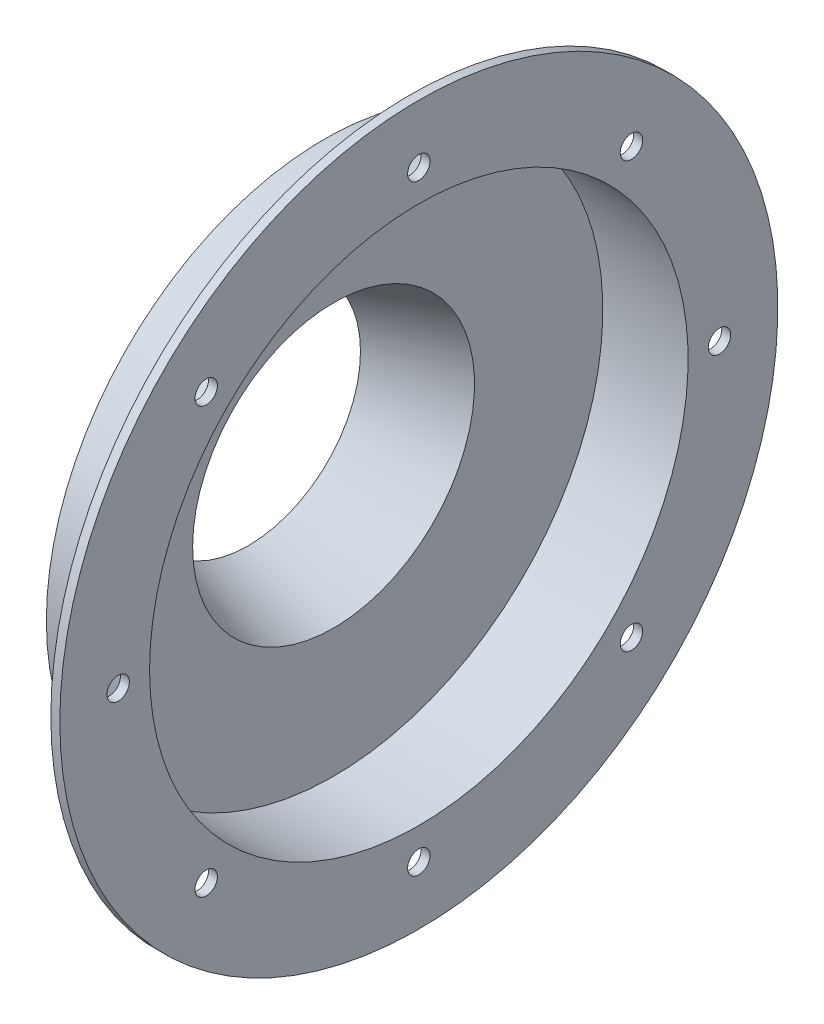
from build123d import *

# Parameters (mm, degrees)
SKETCH2_R          = 3.175
CUT_EXTRUDE1_DEPTH = 2.54
CIRPATTERN1_COUNT  = 8


with BuildPart() as part:
    # Sketch1 → Revolve1 (revolve)
    with BuildSketch(Plane.XY):
        Polygon((0, 31.75), (24.13, 39.878), (24.13, 76.2), (48.26, 76.2), (48.26, 101.6), (45.72, 101.6), (45.72, 78.74), (21.59, 78.74), (21.59, 41.702647785), (-0.810815928, 34.157109788), align=None)
    revolve(axis=Axis((0, 0, 0), (1, 0, 0)))

    # Sketch2 → Cut-Extrude1 (cut)
    with BuildSketch(Plane.ZY.offset(-45.72)):
        with Locations((0, 85.09)):
            Circle(SKETCH2_R)
    cut_extrude1 = extrude(amount=-CUT_EXTRUDE1_DEPTH, mode=Mode.SUBTRACT)

    # CirPattern1: Cut-Extrude1 ×8 about axis
    cirpattern1_axis = Axis((45.72, 0, 0), (-1, 0, 0))
    for i in range(1, CIRPATTERN1_COUNT):
        add(cut_extrude1.rotate(cirpattern1_axis, i * 360 / CIRPATTERN1_COUNT), mode=Mode.SUBTRACT)


solid = part.part
